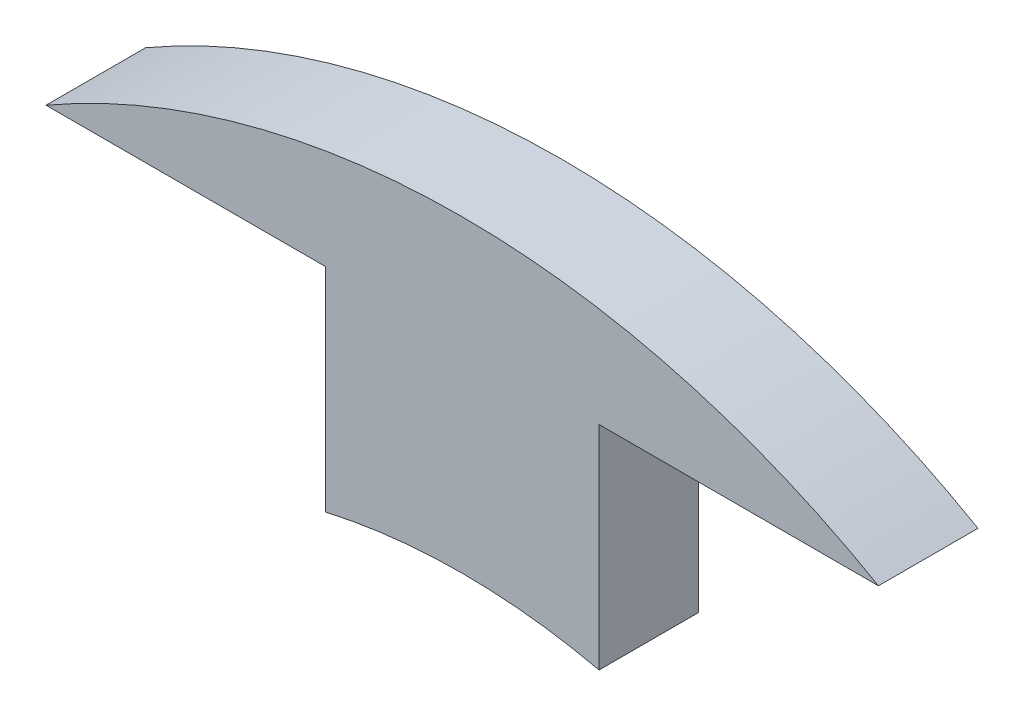
from build123d import *

# Parameters (mm, degrees)
BOSS_EXTRUDE1_DEPTH = 3.03


with BuildPart() as part:
    # Sketch4 → Boss-Extrude1 (new body)
    with BuildSketch(Plane.XY):
        with BuildLine():
            Line((-12.664101615, 24.75), (-4.164101615, 24.75))
            Line((-4.164101615, 24.75), (-4.164101615, 18.281760247))
            ThreePointArc((-4.164101615, 18.281760247), (0, 18.75), (4.164101615, 18.281760247))
            Line((4.164101615, 18.281760247), (4.164101615, 24.75))
            Line((4.164101615, 24.75), (12.664101615, 24.75))
            ThreePointArc((12.664101615, 24.75), (0, 28.143335801), (-12.664101615, 24.75))
        make_face()
    extrude(amount=BOSS_EXTRUDE1_DEPTH)


solid = part.part
